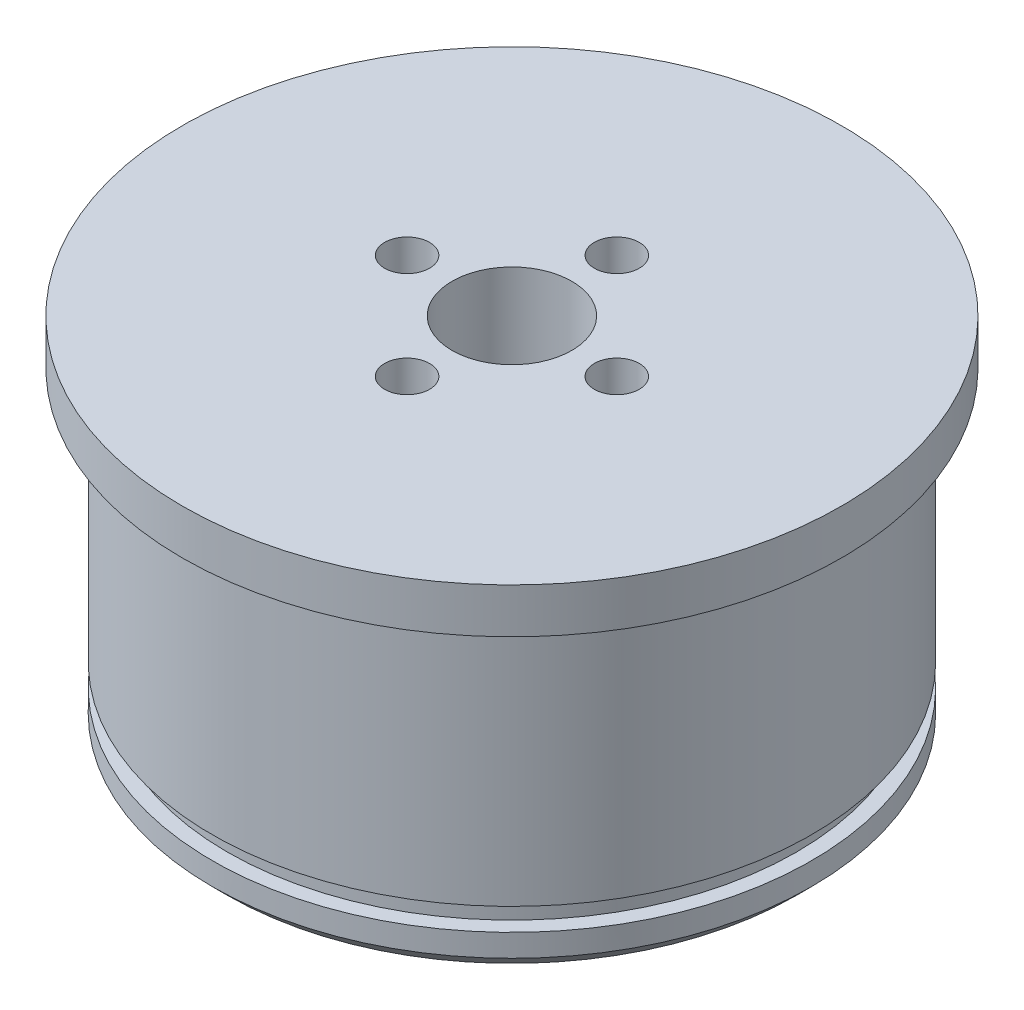
from build123d import *

# Parameters (mm, degrees)
SKETCH_1_R               = 20
EXTRUDE_1_DEPTH          = 21
SKETCH_2_R               = 10
CUT_EXTRUDE_2_DEPTH      = 2.5
SKETCH_5_R               = 20
SKETCH_5_R_2             = 19
CUT_EXTRUDE_5_DEPTH      = 1.5
CHAMFER_1_SIZE           = 1
SKETCH_6_R               = 22
EXTRUDE_2_DEPTH          = 3
SKETCH_4_R               = 1.5
CUT_EXTRUDE_6_DEPTH      = 38.818646195
PATTERN_CIRCULAR_1_COUNT = 4
SKETCH_7_R               = 4
CUT_EXTRUDE_7_DEPTH      = 40.293765409


with BuildPart() as part:
    # Эскиз1 → Бобышка-Вытянуть1 (new body)
    with BuildSketch(Plane(origin=(0, 0, 0), x_dir=(1, 0, 0), z_dir=(0, 1, 0))):
        Circle(SKETCH_1_R)
    extrude(amount=EXTRUDE_1_DEPTH)

    # Эскиз2 → Вырез-Вытянуть2 (cut)
    with BuildSketch(Plane.XZ):
        Circle(SKETCH_2_R)
    extrude(amount=-CUT_EXTRUDE_2_DEPTH, mode=Mode.SUBTRACT)

    # Эскиз5 → Вырез-Вытянуть5 (cut)
    with BuildSketch(Plane(origin=(0, 2.5, 0), x_dir=(-1, 0, 0), z_dir=(0, -1, 0))):
        Circle(SKETCH_5_R)
        Circle(SKETCH_5_R_2, mode=Mode.SUBTRACT)
    extrude(amount=-CUT_EXTRUDE_5_DEPTH, mode=Mode.SUBTRACT)

    # Фаска1
    chamfer_1_edges = [part.edges().sort_by_distance(p)[0] for p in [
        (-20, 0, 0),
    ]]
    chamfer(chamfer_1_edges, length=CHAMFER_1_SIZE)

    # Эскиз6 → Бобышка-Вытянуть2 (add)
    with BuildSketch(Plane(origin=(0, 21, 0), x_dir=(1, 0, 0), z_dir=(0, 1, 0))):
        Circle(SKETCH_6_R)
    extrude(amount=EXTRUDE_2_DEPTH)

    # Эскиз4 → Вырез-Вытянуть6 (cut, through all)
    with BuildSketch(Plane.XZ.offset(-2.5)):
        with Locations((0, 7)):
            Circle(SKETCH_4_R)
    cut_extrude_6 = extrude(amount=-CUT_EXTRUDE_6_DEPTH, mode=Mode.SUBTRACT)

    # Круговой массив1: Вырез-Вытянуть6 ×4 about axis
    pattern_circular_1_axis = Axis((0, 2.5, 0), (0, -1, 0))
    for i in range(1, PATTERN_CIRCULAR_1_COUNT):
        add(cut_extrude_6.rotate(pattern_circular_1_axis, i * 360 / PATTERN_CIRCULAR_1_COUNT), mode=Mode.SUBTRACT)

    # Эскиз7 → Вырез-Вытянуть7 (cut, through all)
    with BuildSketch(Plane(origin=(0, 24, 0), x_dir=(1, 0, 0), z_dir=(0, 1, 0))):
        Circle(SKETCH_7_R)
    extrude(amount=-CUT_EXTRUDE_7_DEPTH, mode=Mode.SUBTRACT)


solid = part.part
